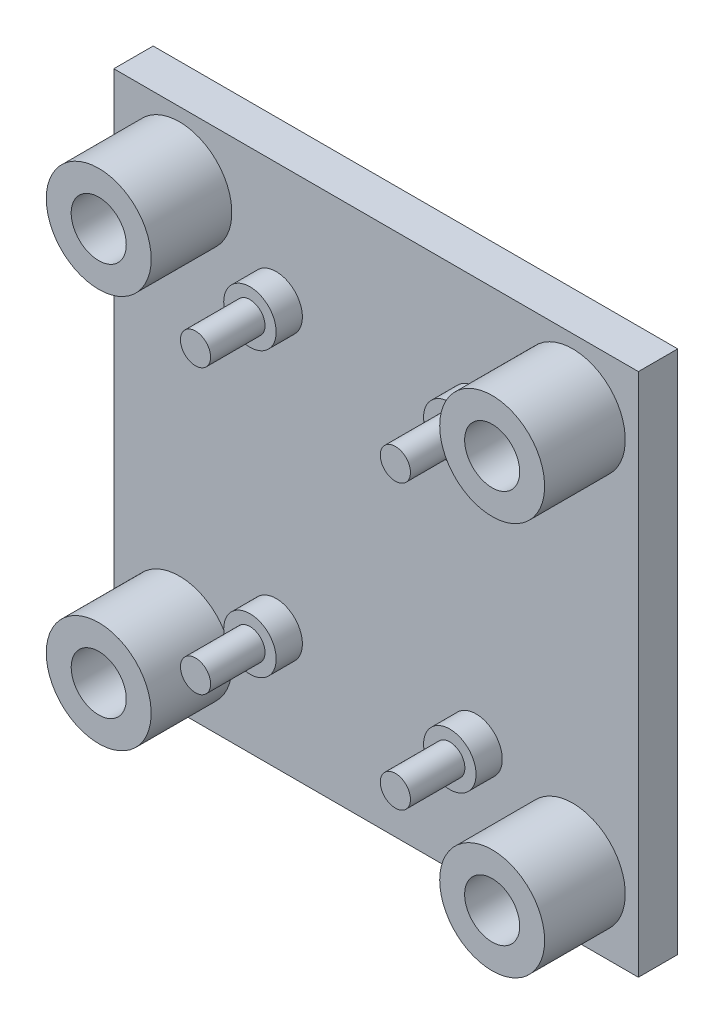
from build123d import *

# Parameters (mm, degrees)
SKETCH_1_W          = 40
SKETCH_1_H          = 40
EXTRUDE_1_DEPTH     = 3
SKETCH_2_R          = 2
EXTRUDE_2_DEPTH     = 2
SKETCH_3_R          = 1.15
EXTRUDE_3_DEPTH     = 4.15
SKETCH_4_R          = 4
EXTRUDE_4_DEPTH     = 6.15
SKETCH_5_R          = 2.1
CUT_EXTRUDE_1_DEPTH = 30.727470461


with BuildPart() as part:
    # 草圖1 → 填料-伸長1 (new body)
    with BuildSketch(Plane.XY):
        Rectangle(SKETCH_1_W, SKETCH_1_H)
    extrude(amount=EXTRUDE_1_DEPTH)

    # 草圖2 → 填料-伸長2 (add)
    with BuildSketch(Plane.XY.offset(3)):
        with Locations((-7.62, 10.795)):
            Circle(SKETCH_2_R)
        with Locations((-7.62, -10.795)):
            Circle(SKETCH_2_R)
        with Locations((7.62, 10.795)):
            Circle(SKETCH_2_R)
        with Locations((7.62, -10.795)):
            Circle(SKETCH_2_R)
    extrude(amount=EXTRUDE_2_DEPTH)

    # 草圖3 → 填料-伸長3 (add)
    with BuildSketch(Plane.XY.offset(5)):
        with Locations((-7.62, 10.795)):
            Circle(SKETCH_3_R)
        with Locations((-7.62, -10.795)):
            Circle(SKETCH_3_R)
        with Locations((7.62, -10.795)):
            Circle(SKETCH_3_R)
        with Locations((7.62, 10.795)):
            Circle(SKETCH_3_R)
    extrude(amount=EXTRUDE_3_DEPTH)

    # 草圖4 → 填料-伸長4 (add)
    with BuildSketch(Plane.XY.offset(3)):
        with Locations((-15, 15)):
            Circle(SKETCH_4_R)
        with Locations((-15, -15)):
            Circle(SKETCH_4_R)
        with Locations((15, -15)):
            Circle(SKETCH_4_R)
        with Locations((15, 15)):
            Circle(SKETCH_4_R)
    extrude(amount=EXTRUDE_4_DEPTH)

    # 草圖5 → 除料-伸長1 (cut, through all)
    with BuildSketch(Plane.XY.offset(9.15)):
        with Locations((-15, 15)):
            Circle(SKETCH_5_R)
        with Locations((-15, -15)):
            Circle(SKETCH_5_R)
        with Locations((15, -15)):
            Circle(SKETCH_5_R)
        with Locations((15, 15)):
            Circle(SKETCH_5_R)
    extrude(amount=-CUT_EXTRUDE_1_DEPTH, mode=Mode.SUBTRACT)


solid = part.part
